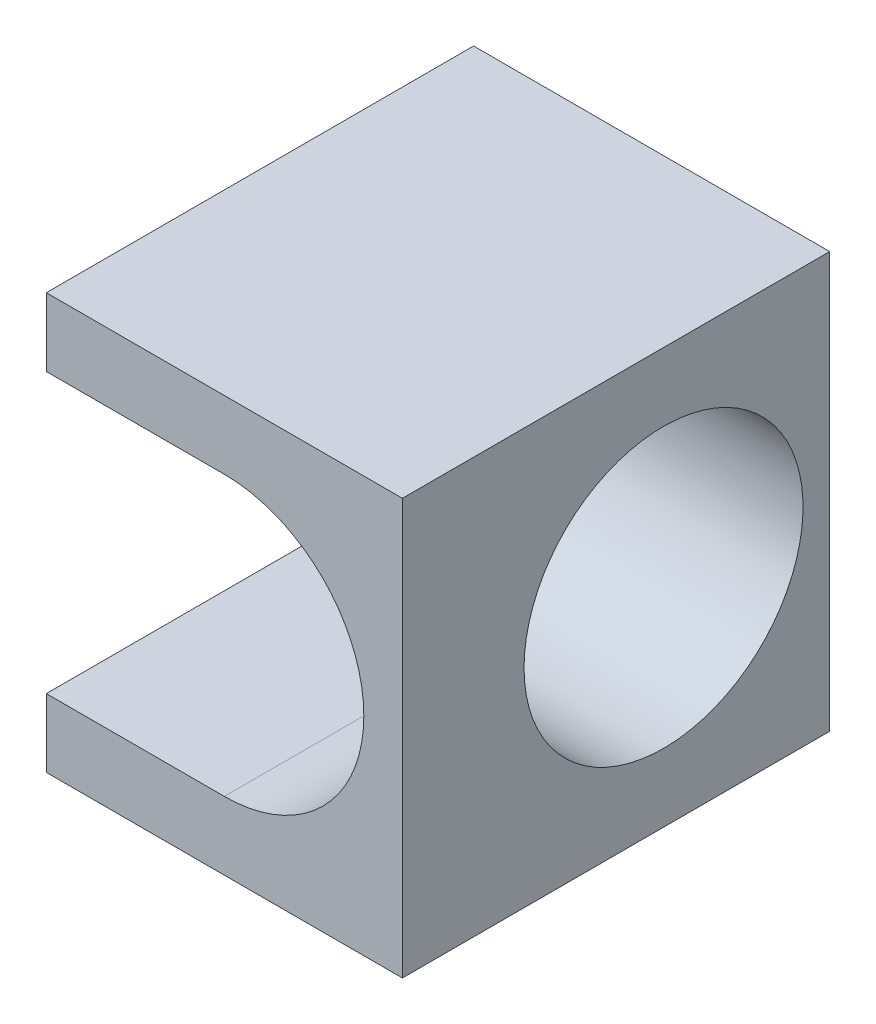
from build123d import *

# Parameters (mm, degrees)
SKETCH1_W           = 30
SKETCH1_H           = 36
BOSS_EXTRUDE1_DEPTH = 35
SKETCH2_R           = 11.75
CUT_EXTRUDE1_DEPTH  = 50.487372127
CUT_EXTRUDE2_DEPTH  = 22.5


with BuildPart() as part:
    # Sketch1 → Boss-Extrude1 (new body)
    with BuildSketch(Plane(origin=(0, 0, 0), x_dir=(1, 0, 0), z_dir=(0, 1, 0))):
        Rectangle(SKETCH1_W, SKETCH1_H)
    extrude(amount=BOSS_EXTRUDE1_DEPTH)

    # Sketch2 → Cut-Extrude1 (cut, through all)
    with BuildSketch(Plane.ZY.offset(15)):
        with Locations((-4, 17.5)):
            Circle(SKETCH2_R)
    extrude(amount=-CUT_EXTRUDE1_DEPTH, mode=Mode.SUBTRACT)

    # Sketch3 → Cut-Extrude2 (cut)
    with BuildSketch(Plane.XY.offset(18)):
        with BuildLine():
            Line((0, 29.25), (-15, 29.25))
            Line((-15, 29.25), (-15, 5.75))
            Line((-15, 5.75), (0, 5.75))
            ThreePointArc((0, 5.75), (11.75, 17.5), (0, 29.25))
        make_face()
    extrude(amount=-CUT_EXTRUDE2_DEPTH, mode=Mode.SUBTRACT)


solid = part.part
